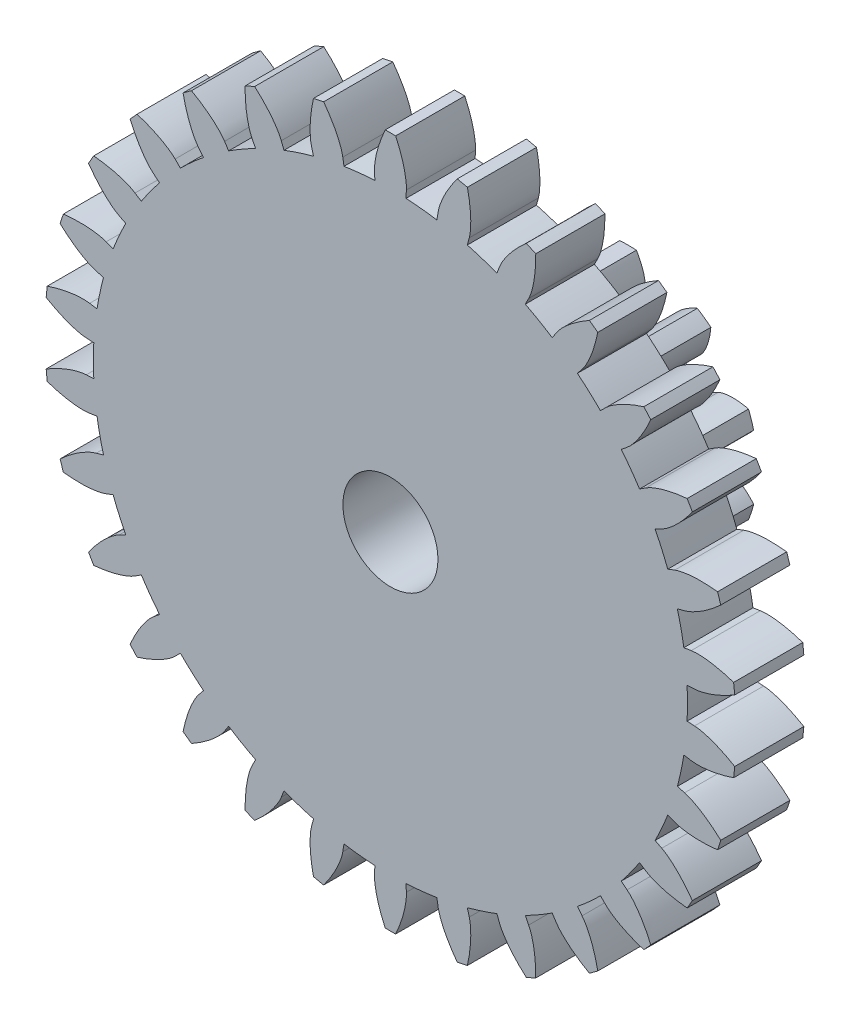
from build123d import *

# Parameters (mm, degrees)
SKETCH_1_R               = 3
SKETCH_1_R_2             = 1.1
EXTRUDE_1_DEPTH          = 3.9
CUT_EXTRUDE_1_DEPTH      = 6.762811814
PATTERN_CIRCULAR_1_COUNT = 10
PATTERN_CIRCULAR_1_ANGLE = 324
SKETCH_2_R               = 8
SKETCH_2_R_2             = 1.1
EXTRUDE_2_DEPTH          = 1.6
CUT_EXTRUDE_3_DEPTH      = 12.967038229
PATTERN_CIRCULAR_2_COUNT = 30


with BuildPart() as part:
    # 草图1 → 凸台-拉伸1 (new body)
    with BuildSketch(Plane.XY):
        Circle(SKETCH_1_R)
        Circle(SKETCH_1_R_2, mode=Mode.SUBTRACT)
    extrude(amount=EXTRUDE_1_DEPTH)

    # 草图1<3> → 切除-拉伸1 (cut, through all)
    with BuildSketch(Plane.XY):
        with BuildLine():
            Line((2.32404424, 0.34308491), (1.854897167, 0.273827502))
            ThreePointArc((1.854897167, 0.273827502), (1.869967538, 0.137282213), (1.875, 0))
            ThreePointArc((1.875, 0), (1.869967538, -0.137282213), (1.854897167, -0.273827502))
            Line((1.854897167, -0.273827502), (2.32404424, -0.34308491))
            add(Edge.make_bspline(
                [(2.32404424, -0.34308491), (2.341759801, -0.345700154), (2.390654467, -0.356680366), (2.480003701, -0.392068726), (2.61555699, -0.468743726), (2.742843787, -0.569725263), (2.835064857, -0.660865824), (2.891013955, -0.723601117), (2.906804856, -0.741947122)],
                knots=[0, 0, 0, 0, 0, 0.005604068, 0.015718248, 0.029959916, 0.048733667, 0.056327581, 0.056327581, 0.056327581, 0.056327581, 0.056327581], degree=4))
            ThreePointArc((2.906804856, -0.741947122), (2.976610032, -0.373888642), (3, 0))
            ThreePointArc((3, 0), (2.976610032, 0.373888642), (2.906804856, 0.741947122))
            add(Edge.make_bspline(
                [(2.32404424, 0.34308491), (2.341759801, 0.345700154), (2.390654467, 0.356680366), (2.480003701, 0.392068726), (2.61555699, 0.468743726), (2.742843787, 0.569725263), (2.835064857, 0.660865824), (2.891013955, 0.723601117), (2.906804856, 0.741947122)],
                knots=[0, 0, 0, 0, 0, 0.005604068, 0.015718248, 0.029959916, 0.048733667, 0.056327581, 0.056327581, 0.056327581, 0.056327581, 0.056327581], degree=4))
        make_face()
    cut_extrude_1 = extrude(amount=CUT_EXTRUDE_1_DEPTH, mode=Mode.SUBTRACT)

    # 阵列(圆周)1: 切除-拉伸1 ×10 about axis
    pattern_circular_1_axis = Axis((0, 0, 3.9), (0, 0, 1))
    for i in range(1, PATTERN_CIRCULAR_1_COUNT):
        add(cut_extrude_1.rotate(pattern_circular_1_axis, i * PATTERN_CIRCULAR_1_ANGLE / (PATTERN_CIRCULAR_1_COUNT - 1)), mode=Mode.SUBTRACT)

    # 草图2 → 凸台-拉伸2 (add)
    with BuildSketch(Plane.XY.offset(3.9)):
        Circle(SKETCH_2_R)
        Circle(SKETCH_2_R_2, mode=Mode.SUBTRACT)
    extrude(amount=EXTRUDE_2_DEPTH)

    # 草图2<3> → 切除-拉伸3 (cut, through all)
    with BuildSketch(Plane.XY.offset(3.9)):
        with BuildLine():
            Line((7.038036043, 0.36884784), (6.865578051, 0.359809699))
            ThreePointArc((6.865578051, 0.359809699), (6.872644109, 0.17996652), (6.875, 0))
            ThreePointArc((6.875, 0), (6.872644109, -0.17996652), (6.865578051, -0.359809699))
            Line((6.865578051, -0.359809699), (7.038036043, -0.36884784))
            add(Edge.make_bspline(
                [(7.038036043, -0.36884784), (7.064832196, -0.370252166), (7.118147629, -0.3755676), (7.266135363, -0.403579842), (7.505235318, -0.479270374), (7.709408426, -0.571203404), (7.882017768, -0.665460475), (7.967862871, -0.716352755)],
                knots=[0, 0, 0, 0, 0, 0.002802034, 0.005604068, 0.015718248, 0.026152267, 0.026152267, 0.026152267, 0.026152267, 0.026152267], degree=4))
            ThreePointArc((7.967862871, -0.716352755), (7.991961679, -0.358536631), (8, 0))
            ThreePointArc((8, 0), (7.991961679, 0.358536631), (7.967862871, 0.716352755))
            add(Edge.make_bspline(
                [(7.038036043, 0.36884784), (7.064832196, 0.370252166), (7.118147629, 0.3755676), (7.266135363, 0.403579842), (7.505235318, 0.479270374), (7.709408426, 0.571203404), (7.882017768, 0.665460475), (7.967862871, 0.716352755)],
                knots=[0, 0, 0, 0, 0, 0.002802034, 0.005604068, 0.015718248, 0.026152267, 0.026152267, 0.026152267, 0.026152267, 0.026152267], degree=4))
        make_face()
    cut_extrude_3 = extrude(amount=CUT_EXTRUDE_3_DEPTH, mode=Mode.SUBTRACT)

    # 阵列(圆周)2: 切除-拉伸3 ×30 about axis
    pattern_circular_2_axis = Axis((0, 0, 5.5), (0, 0, 1))
    for i in range(1, PATTERN_CIRCULAR_2_COUNT):
        add(cut_extrude_3.rotate(pattern_circular_2_axis, i * 360 / PATTERN_CIRCULAR_2_COUNT), mode=Mode.SUBTRACT)


solid = part.part
